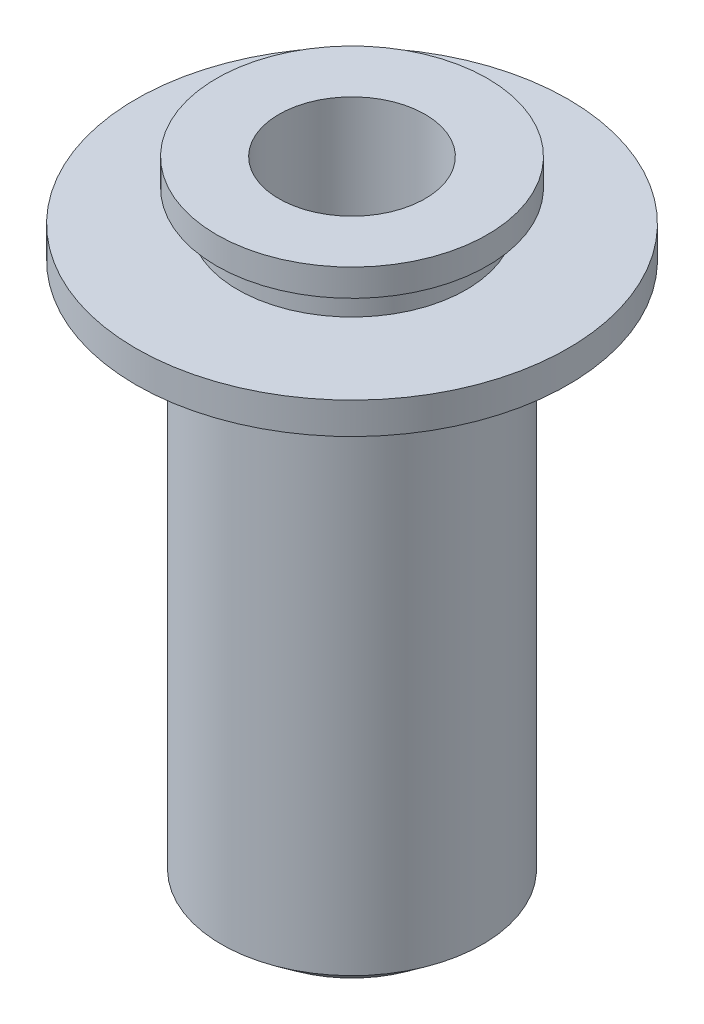
from build123d import *


with BuildPart() as part:
    # Эскиз1 → Повернуть1 (revolve)
    with BuildSketch(Plane.XY):
        Polygon((7.002065787, 0), (7.002065787, 61.592245352), (12.966788495, 61.592245352), (12.966788495, 58.998887653), (10.942232147, 58.998887653), (10.942232147, 56.015893334), (20.6828711, 56.015893334), (20.6828711, 52.994307373), (12.492782837, 52.994307373), (12.492782837, 2.496149852), (9.251459635, 0), align=None)
    revolve(axis=Axis((0, -11.441390283, 0), (0, 1, 0)))


solid = part.part
